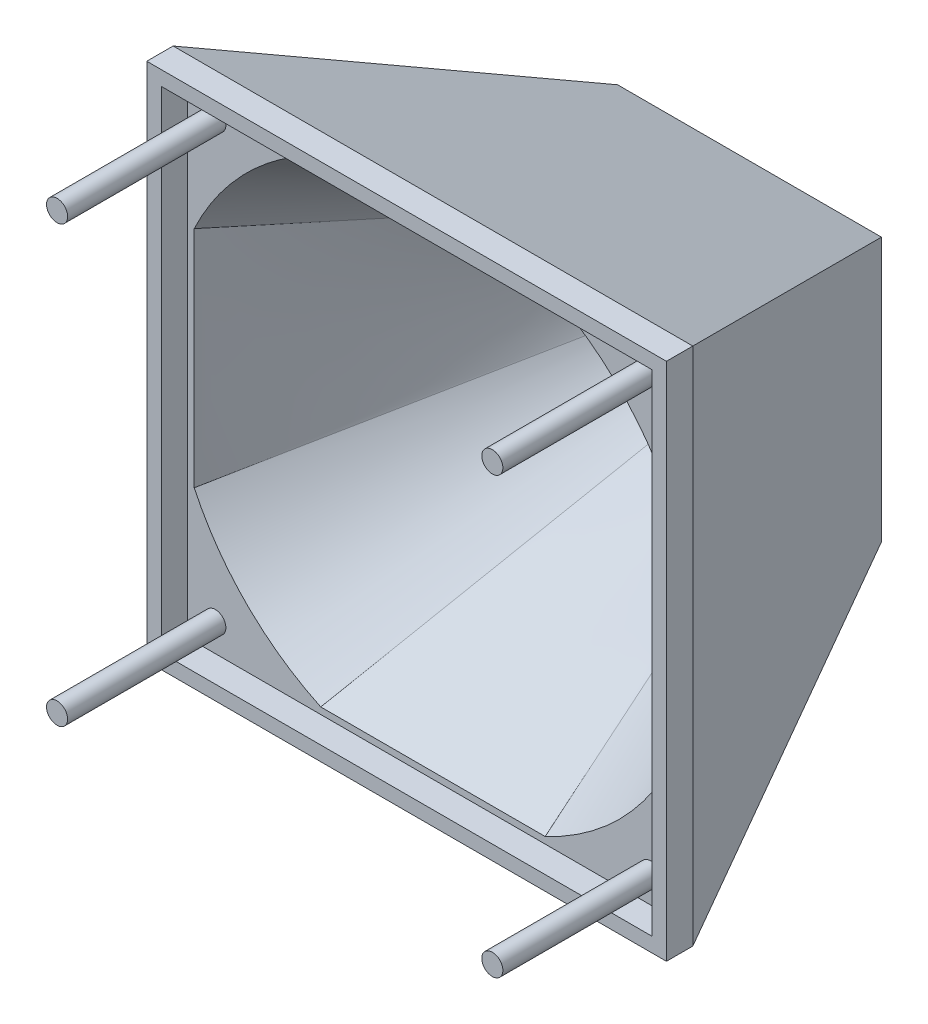
from build123d import *

# Parameters (mm, degrees)
SKIZZE1_W                       = 98.5
SKIZZE1_H                       = 98.5
SKIZZE1_W_2                     = 90.5
SKIZZE1_H_2                     = 90.5
AUFSATZ_LINEAR_AUSTRAGEN2_DEPTH = 5
SKIZZE6_W                       = 98.5
SKIZZE6_H                       = 98.5
AUFSATZ_LINEAR_AUSTRAGEN4_DEPTH = 60
AUFSATZ_LINEAR_AUSTRAGEN4_TAPER = 22
SKIZZE7_W                       = 93
SKIZZE7_H                       = 93
SCHNITT_LINEAR_AUSTRAGEN1_DEPTH = 5
SKIZZE10_R                      = 2
AUFSATZ_LINEAR_AUSTRAGEN5_DEPTH = 30


with BuildPart() as part:
    # Skizze1 → Aufsatz-Linear austragen2 (new body)
    # profile 1 of 5: a face of its own
    with BuildSketch(Plane.XY):
        Rectangle(SKIZZE1_W, SKIZZE1_H)
        Rectangle(SKIZZE1_W_2, SKIZZE1_H_2, mode=Mode.SUBTRACT)
    # profile 2 of 5: a face of its own
    with BuildSketch(Plane.XY):
        with BuildLine():
            Line((-45.25, 45.25), (-45.25, 21.270578271))
            ThreePointArc((-45.25, 21.270578271), (-35.355339059, 35.355339059), (-21.270578271, 45.25))
            Line((-21.270578271, 45.25), (-45.25, 45.25))
        make_face()
    # profile 3 of 5: a face of its own
    with BuildSketch(Plane.XY):
        with BuildLine():
            ThreePointArc((21.270578271, 45.25), (35.355339059, 35.355339059), (45.25, 21.270578271))
            Line((45.25, 21.270578271), (45.25, 45.25))
            Line((45.25, 45.25), (21.270578271, 45.25))
        make_face()
    # profile 4 of 5: a face of its own
    with BuildSketch(Plane.XY):
        with BuildLine():
            ThreePointArc((45.25, -21.270578271), (35.355339059, -35.355339059), (21.270578271, -45.25))
            Line((21.270578271, -45.25), (45.25, -45.25))
            Line((45.25, -45.25), (45.25, -21.270578271))
        make_face()
    # profile 5 of 5: a face of its own
    with BuildSketch(Plane.XY):
        with BuildLine():
            Line((-45.25, -21.270578271), (-45.25, -45.25))
            Line((-45.25, -45.25), (-21.270578271, -45.25))
            ThreePointArc((-21.270578271, -45.25), (-35.355339059, -35.355339059), (-45.25, -21.270578271))
        make_face()
    extrude(amount=AUFSATZ_LINEAR_AUSTRAGEN2_DEPTH)

    # Skizze6 → Aufsatz-Linear austragen4 (add)
    with BuildSketch(Plane(origin=(0, 0, 0), x_dir=(-1, 0, 0), z_dir=(0, 0, -1))):
        Rectangle(SKIZZE6_W, SKIZZE6_H)
    extrude(amount=AUFSATZ_LINEAR_AUSTRAGEN4_DEPTH, taper=AUFSATZ_LINEAR_AUSTRAGEN4_TAPER)

    # Schnitt-Ausformung4: read off the stored shape, not the designer's step
    # Schnitt-Ausformung4: loft between two sections, ruled curve by curve
    schnitt_ausformung4_from = [
        Edge.make_bspline([(45.25, 21.270578271, 0), (45.25, 17.725481893, 0), (45.25, 14.180385514, 0), (45.25, 7.090192757, 0), (45.25, 3.545096379, 0), (45.25, -3.545096379, 0), (45.25, -7.090192757, 0), (45.25, -14.180385514, 0), (45.25, -17.725481893, 0), (45.25, -21.270578271, 0)], [0, 0, 0, 0, 0.25, 0.25, 0.5, 0.5, 0.75, 0.75, 1, 1, 1, 1], 3),
        Edge.make_bspline([(21.270578271, -45.25, 0), (17.725481893, -45.25, 0), (14.180385514, -45.25, 0), (7.090192757, -45.25, 0), (3.545096379, -45.25, 0), (-3.545096379, -45.25, 0), (-7.090192757, -45.25, 0), (-14.180385514, -45.25, 0), (-17.725481893, -45.25, 0), (-21.270578271, -45.25, 0)], [0, 0, 0, 0, 0.25, 0.25, 0.5, 0.5, 0.75, 0.75, 1, 1, 1, 1], 3),
        Edge.make_bspline([(-45.25, -21.270578271, 0), (-45.25, -17.725481893, 0), (-45.25, -14.180385514, 0), (-45.25, -7.090192757, 0), (-45.25, -3.545096379, 0), (-45.25, 3.545096379, 0), (-45.25, 7.090192757, 0), (-45.25, 14.180385514, 0), (-45.25, 17.725481893, 0), (-45.25, 21.270578271, 0)], [0, 0, 0, 0, 0.25, 0.25, 0.5, 0.5, 0.75, 0.75, 1, 1, 1, 1], 3),
        Edge.make_bspline([(-21.270578271, 45.25, 0), (-17.725481893, 45.25, 0), (-14.180385514, 45.25, 0), (-7.090192757, 45.25, 0), (-3.545096379, 45.25, 0), (3.545096379, 45.25, 0), (7.090192757, 45.25, 0), (14.180385514, 45.25, 0), (17.725481893, 45.25, 0), (21.270578271, 45.25, 0)], [0, 0, 0, 0, 0.25, 0.25, 0.5, 0.5, 0.75, 0.75, 1, 1, 1, 1], 3),
        Edge.make_three_point_arc((21.270578271, -45.25, 0), (35.355339059, -35.355339059, 0), (45.25, -21.270578271, 0)),
        Edge.make_three_point_arc((-45.25, -21.270578271, 0), (-35.355339059, -35.355339059, 0), (-21.270578271, -45.25, 0)),
        Edge.make_three_point_arc((-21.270578271, 45.25, 0), (-35.355339059, 35.355339059, 0), (-45.25, 21.270578271, 0)),
        Edge.make_three_point_arc((45.25, 21.270578271, 0), (35.355339059, 35.355339059, 0), (21.270578271, 45.25, 0)),
    ]
    schnitt_ausformung4_to = [
        Edge.make_bspline([(18.5525, 8.720937091, -60), (19.17083125, 7.40552908, -60), (19.662710025, 5.991613705, -60), (20.327568653, 3.051483732, -60), (20.5, 1.525973244, -60), (20.5, -1.525973244, -60), (20.327568653, -3.051483732, -60), (19.662710025, -5.991613705, -60), (19.17083125, -7.40552908, -60), (18.5525, -8.720937091, -60)], [0, 0, 0, 0, 0.25, 0.25, 0.5, 0.5, 0.75, 0.75, 1, 1, 1, 1], 3),
        Edge.make_bspline([(8.720937091, -18.5525, -60), (7.40552908, -19.17083125, -60), (5.991613705, -19.662710025, -60), (3.051483732, -20.327568653, -60), (1.525973244, -20.5, -60), (-1.525973244, -20.5, -60), (-3.051483732, -20.327568653, -60), (-5.991613705, -19.662710025, -60), (-7.40552908, -19.17083125, -60), (-8.720937091, -18.5525, -60)], [0, 0, 0, 0, 0.25, 0.25, 0.5, 0.5, 0.75, 0.75, 1, 1, 1, 1], 3),
        Edge.make_bspline([(-18.5525, -8.720937091, -60), (-19.17083125, -7.40552908, -60), (-19.662710025, -5.991613705, -60), (-20.327568653, -3.051483732, -60), (-20.5, -1.525973244, -60), (-20.5, 1.525973244, -60), (-20.327568653, 3.051483732, -60), (-19.662710025, 5.991613705, -60), (-19.17083125, 7.40552908, -60), (-18.5525, 8.720937091, -60)], [0, 0, 0, 0, 0.25, 0.25, 0.5, 0.5, 0.75, 0.75, 1, 1, 1, 1], 3),
        Edge.make_bspline([(-8.720937091, 18.5525, -60), (-7.40552908, 19.17083125, -60), (-5.991613705, 19.662710025, -60), (-3.051483732, 20.327568653, -60), (-1.525973244, 20.5, -60), (1.525973244, 20.5, -60), (3.051483732, 20.327568653, -60), (5.991613705, 19.662710025, -60), (7.40552908, 19.17083125, -60), (8.720937091, 18.5525, -60)], [0, 0, 0, 0, 0.25, 0.25, 0.5, 0.5, 0.75, 0.75, 1, 1, 1, 1], 3),
        Edge.make_three_point_arc((8.720937091, -18.5525, -60), (14.495689014, -14.495689014, -60), (18.5525, -8.720937091, -60)),
        Edge.make_three_point_arc((-18.5525, -8.720937091, -60), (-14.495689014, -14.495689014, -60), (-8.720937091, -18.5525, -60)),
        Edge.make_three_point_arc((-8.720937091, 18.5525, -60), (-14.495689014, 14.495689014, -60), (-18.5525, 8.720937091, -60)),
        Edge.make_three_point_arc((18.5525, 8.720937091, -60), (14.495689014, 14.495689014, -60), (8.720937091, 18.5525, -60)),
    ]
    schnitt_ausformung4 = Solid(Shell([*[Face.make_surface_from_curves(schnitt_ausformung4_from[k], schnitt_ausformung4_to[k]) for k in range(8)], Face(Wire(schnitt_ausformung4_from)), Face(Wire(schnitt_ausformung4_to))]))
    add(schnitt_ausformung4, mode=Mode.SUBTRACT)

    # Skizze7 → Schnitt-Linear austragen1 (cut)
    with BuildSketch(Plane.XY):
        Rectangle(SKIZZE7_W, SKIZZE7_H)
    extrude(amount=SCHNITT_LINEAR_AUSTRAGEN1_DEPTH, mode=Mode.SUBTRACT)

    # Skizze10 → Aufsatz-Linear austragen5 (add)
    with BuildSketch(Plane.XY):
        with Locations((41.25, 41.25)):
            Circle(SKIZZE10_R)
        with Locations((41.25, -41.25)):
            Circle(SKIZZE10_R)
        with Locations((-41.25, -41.25)):
            Circle(SKIZZE10_R)
        with Locations((-41.25, 41.25)):
            Circle(SKIZZE10_R)
    extrude(amount=AUFSATZ_LINEAR_AUSTRAGEN5_DEPTH)


solid = part.part
